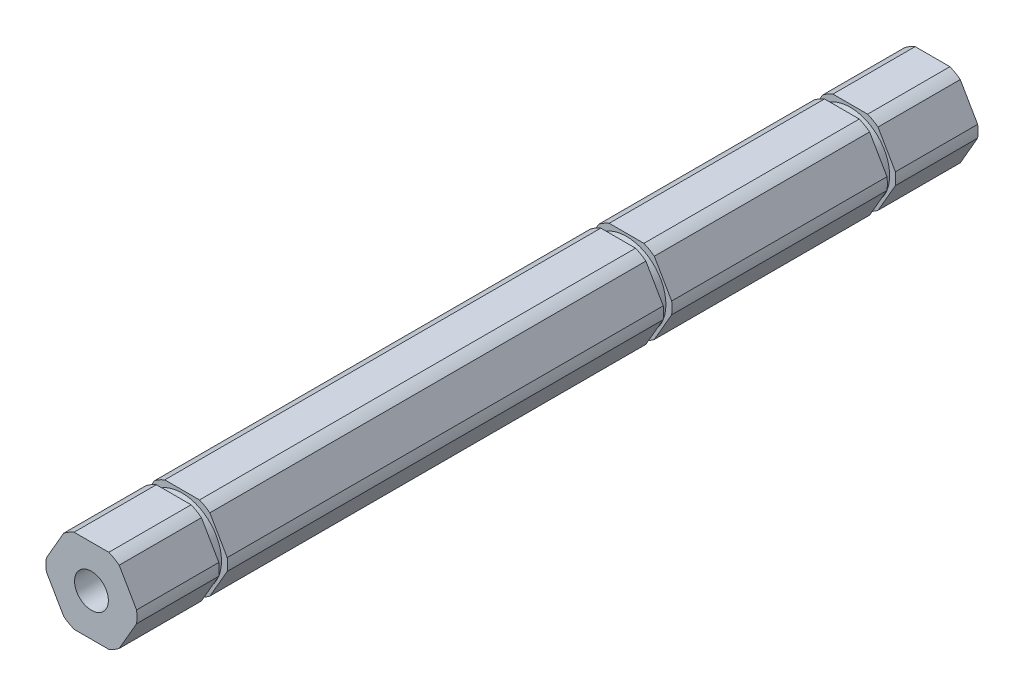
from build123d import *

# Parameters (mm, degrees)
BOSS_EXTRUDE1_DEPTH        = 32.512
SKETCH2_R                  = 5.9436
BOSS_EXTRUDE2_DEPTH        = 1.27
BOSS_EXTRUDE3_START        = 1.27
SKETCH3_R                  = 5.9436
BOSS_EXTRUDE3_DEPTH        = 1.27
BOSS_EXTRUDE4_START        = -65.8368
BOSS_EXTRUDE4_DEPTH        = 65.8368
BOSS_EXTRUDE5_DEPTH        = 12.4206
BOSS_EXTRUDE6_START        = 1.27
SKETCH6_R                  = 5.9436
BOSS_EXTRUDE6_DEPTH        = 1.27
BOSS_EXTRUDE7_START        = -12.4206
BOSS_EXTRUDE7_DEPTH        = 12.4206
F_7_0_201_DIAMETER_HOLE1_D = 5.1054


with BuildPart() as part:
    # Sketch1 → Boss-Extrude1 (new body)
    with BuildSketch(Plane.XY.offset(-17.2974)):
        with BuildLine():
            Line((-4.187390656, 5.447226632), (-6.811131972, 0.902773368))
            ThreePointArc((-6.811131972, 0.902773368), (-6.8707, 0), (-6.811131972, -0.902773368))
            Line((-6.811131972, -0.902773368), (-4.187390656, -5.447226632))
            ThreePointArc((-4.187390656, -5.447226632), (-3.43535, -5.950200742), (-2.623741315, -6.35))
            Line((-2.623741315, -6.35), (2.623741315, -6.35))
            ThreePointArc((2.623741315, -6.35), (3.43535, -5.950200742), (4.187390656, -5.447226632))
            Line((4.187390656, -5.447226632), (6.811131972, -0.902773368))
            ThreePointArc((6.811131972, -0.902773368), (6.8707, 0), (6.811131972, 0.902773368))
            Line((6.811131972, 0.902773368), (4.187390656, 5.447226632))
            ThreePointArc((4.187390656, 5.447226632), (3.43535, 5.950200742), (2.623741315, 6.35))
            Line((2.623741315, 6.35), (-2.623741315, 6.35))
            ThreePointArc((-2.623741315, 6.35), (-3.43535, 5.950200742), (-4.187390656, 5.447226632))
        make_face()
    extrude(amount=-BOSS_EXTRUDE1_DEPTH)

    # Sketch2 → Boss-Extrude2 (add)
    with BuildSketch(Plane(origin=(0, 0, -49.8094), x_dir=(-1, 0, 0), z_dir=(0, 0, -1))):
        Circle(SKETCH2_R)
    extrude(amount=BOSS_EXTRUDE2_DEPTH)

    # Sketch3 → Boss-Extrude3 (add)
    with BuildSketch(Plane.XY.offset(-17.2974).offset(BOSS_EXTRUDE3_START)):
        Circle(SKETCH3_R)
    extrude(amount=-BOSS_EXTRUDE3_DEPTH)

    # Sketch4 → Boss-Extrude4 (add)
    with BuildSketch(Plane(origin=(0, 0, -16.0274), x_dir=(-1, 0, 0), z_dir=(0, 0, -1)).offset(BOSS_EXTRUDE4_START)):
        with BuildLine():
            Line((2.623741315, 6.35), (-2.623741315, 6.35))
            ThreePointArc((-2.623741315, 6.35), (-3.43535, 5.950200742), (-4.187390656, 5.447226632))
            Line((-4.187390656, 5.447226632), (-6.811131972, 0.902773368))
            ThreePointArc((-6.811131972, 0.902773368), (-6.8707, 0), (-6.811131972, -0.902773368))
            Line((-6.811131972, -0.902773368), (-4.187390656, -5.447226632))
            ThreePointArc((-4.187390656, -5.447226632), (-3.43535, -5.950200742), (-2.623741315, -6.35))
            Line((-2.623741315, -6.35), (2.623741315, -6.35))
            ThreePointArc((2.623741315, -6.35), (3.43535, -5.950200742), (4.187390656, -5.447226632))
            Line((4.187390656, -5.447226632), (6.811131972, -0.902773368))
            ThreePointArc((6.811131972, -0.902773368), (6.8707, 0), (6.811131972, 0.902773368))
            Line((6.811131972, 0.902773368), (4.187390656, 5.447226632))
            ThreePointArc((4.187390656, 5.447226632), (3.43535, 5.950200742), (2.623741315, 6.35))
        make_face()
    extrude(amount=BOSS_EXTRUDE4_DEPTH)

    # Sketch5 → Boss-Extrude5 (add)
    with BuildSketch(Plane.XY.offset(-51.0794)):
        with BuildLine():
            Line((-4.187390656, 5.447226632), (-6.811131972, 0.902773368))
            ThreePointArc((-6.811131972, 0.902773368), (-6.8707, 0), (-6.811131972, -0.902773368))
            Line((-6.811131972, -0.902773368), (-4.187390656, -5.447226632))
            ThreePointArc((-4.187390656, -5.447226632), (-3.43535, -5.950200742), (-2.623741315, -6.35))
            Line((-2.623741315, -6.35), (2.623741315, -6.35))
            ThreePointArc((2.623741315, -6.35), (3.43535, -5.950200742), (4.187390656, -5.447226632))
            Line((4.187390656, -5.447226632), (6.811131972, -0.902773368))
            ThreePointArc((6.811131972, -0.902773368), (6.8707, 0), (6.811131972, 0.902773368))
            Line((6.811131972, 0.902773368), (4.187390656, 5.447226632))
            ThreePointArc((4.187390656, 5.447226632), (3.43535, 5.950200742), (2.623741315, 6.35))
            Line((2.623741315, 6.35), (-2.623741315, 6.35))
            ThreePointArc((-2.623741315, 6.35), (-3.43535, 5.950200742), (-4.187390656, 5.447226632))
        make_face()
    extrude(amount=-BOSS_EXTRUDE5_DEPTH)

    # Sketch6 → Boss-Extrude6 (add)
    with BuildSketch(Plane.XY.offset(49.8094).offset(BOSS_EXTRUDE6_START)):
        Circle(SKETCH6_R)
    extrude(amount=-BOSS_EXTRUDE6_DEPTH)

    # Sketch7 → Boss-Extrude7 (add)
    with BuildSketch(Plane(origin=(0, 0, 51.0794), x_dir=(-1, 0, 0), z_dir=(0, 0, -1)).offset(BOSS_EXTRUDE7_START)):
        with BuildLine():
            Line((6.811131972, 0.902773368), (4.187390656, 5.447226632))
            ThreePointArc((4.187390656, 5.447226632), (3.43535, 5.950200742), (2.623741315, 6.35))
            Line((2.623741315, 6.35), (-2.623741315, 6.35))
            ThreePointArc((-2.623741315, 6.35), (-3.43535, 5.950200742), (-4.187390656, 5.447226632))
            Line((-4.187390656, 5.447226632), (-6.811131972, 0.902773368))
            ThreePointArc((-6.811131972, 0.902773368), (-6.8707, 0), (-6.811131972, -0.902773368))
            Line((-6.811131972, -0.902773368), (-4.187390656, -5.447226632))
            ThreePointArc((-4.187390656, -5.447226632), (-3.43535, -5.950200742), (-2.623741315, -6.35))
            Line((-2.623741315, -6.35), (2.623741315, -6.35))
            ThreePointArc((2.623741315, -6.35), (3.43535, -5.950200742), (4.187390656, -5.447226632))
            Line((4.187390656, -5.447226632), (6.811131972, -0.902773368))
            ThreePointArc((6.811131972, -0.902773368), (6.8707, 0), (6.811131972, 0.902773368))
        make_face()
    extrude(amount=BOSS_EXTRUDE7_DEPTH)

    # #7 (0.201) Diameter Hole1 (through all)
    with Locations(Plane(origin=(0, 0, -63.5), x_dir=(-1, 0, 0), z_dir=(0, 0, -1))):
        with Locations((0, 0)):
            Hole(F_7_0_201_DIAMETER_HOLE1_D / 2)


solid = part.part
